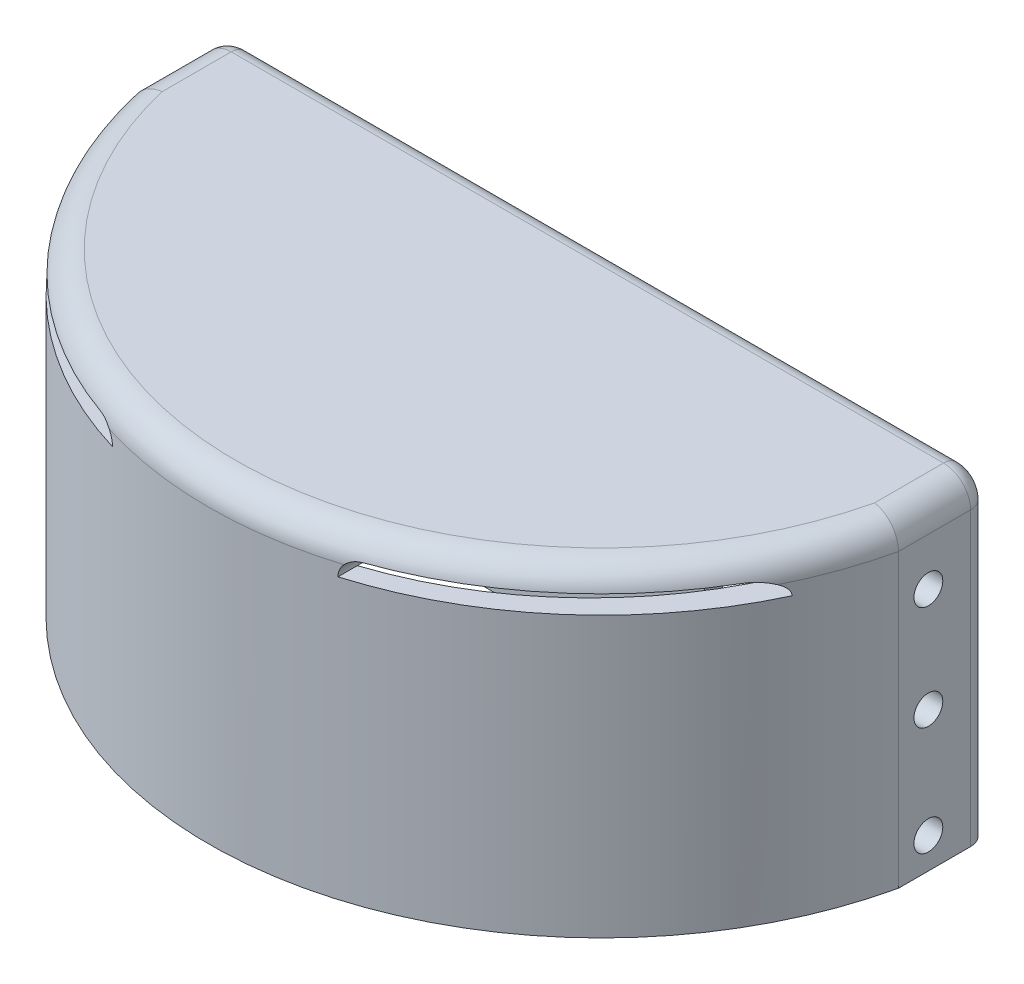
from build123d import *

# Parameters (mm, degrees)
IZIM1_R                          = 2.5
Y_KSEKLIK_EKSTR_ZYON1_DEPTH      = 2
IZIM2_W                          = 25
IZIM2_H                          = 31
Y_KSEKLIK_EKSTR_ZYON2_DEPTH      = 2
IZIM3_W                          = 0.888238836
IZIM3_H                          = 3.17016103
KES_EKSTR_ZYON1_DEPTH            = 2
IZIM6_W                          = 3
IZIM6_H                          = 31
Y_KSEKLIK_EKSTR_ZYON3_DEPTH      = 10
IZIM7_R                          = 1.6
KES_EKSTR_ZYON2_DEPTH            = 141
IZIM8_W                          = 4.55247788
IZIM8_H                          = 5.743045402
Y_KSEKLIK_EKSTR_ZYON4_DEPTH      = 2
Y_KSEKLIK_EKSTR_ZYON5_DEPTH      = 31
Y_KSEKLIK_EKSTR_ZYON6_REACH      = 85.274
Y_KSEKLIK_EKSTR_ZYON6_END_RADIUS = 43.5625
RADYUS1_R                        = 3
RADYUS2_R                        = 2
IZIM11_W                         = 25
IZIM11_H                         = 20
KES_EKSTR_ZYON3_DEPTH            = 10
Y_KSEKLIK_EKSTR_ZYON7_DEPTH      = 2


with BuildPart() as part:
    # Çizim1 → Yükseklik-Ekstrüzyon1 (new body)
    with BuildSketch(Plane.XY):
        with BuildLine():
            Line((-11.5, 17.5), (11.5, 17.5))
            ThreePointArc((11.5, 17.5), (12.914213562, 16.914213562), (13.5, 15.5))
            Line((13.5, 15.5), (13.5, -15.5))
            ThreePointArc((13.5, -15.5), (12.914213562, -16.914213562), (11.5, -17.5))
            Line((11.5, -17.5), (-11.5, -17.5))
            ThreePointArc((-11.5, -17.5), (-12.914213562, -16.914213562), (-13.5, -15.5))
            Line((-13.5, -15.5), (-13.5, 15.5))
            ThreePointArc((-13.5, 15.5), (-12.914213562, 16.914213562), (-11.5, 17.5))
        make_face()
        with Locations((-10, 14)):
            Circle(IZIM1_R, mode=Mode.SUBTRACT)
        with Locations((-10, -14)):
            Circle(IZIM1_R, mode=Mode.SUBTRACT)
        with Locations((10, 14)):
            Circle(IZIM1_R, mode=Mode.SUBTRACT)
        with Locations((10, -14)):
            Circle(IZIM1_R, mode=Mode.SUBTRACT)
    y_kseklik_ekstr_zyon1 = extrude(amount=Y_KSEKLIK_EKSTR_ZYON1_DEPTH)

    # Çizim2 → Yükseklik-Ekstrüzyon2 (add)
    with BuildSketch(Plane(origin=(0, 0, 0), x_dir=(-1, 0, 0), z_dir=(0, 0, -1))):
        with Locations((26, 0)):
            Rectangle(IZIM2_W, IZIM2_H)
    extrude(amount=-Y_KSEKLIK_EKSTR_ZYON2_DEPTH)

    # Çizim3 → Kes-Ekstrüzyon1 (cut)
    with BuildSketch(Plane(origin=(0, 0, 0), x_dir=(-1, 0, 0), z_dir=(0, 0, -1))):
        with Locations((26.444119418, 13.914919485)):
            Rectangle(IZIM3_W, IZIM3_H)
    extrude(amount=-KES_EKSTR_ZYON1_DEPTH, mode=Mode.SUBTRACT)

    # Aynalama4: Yükseklik-Ekstrüzyon1 across plane
    add(y_kseklik_ekstr_zyon1.mirror(Plane(origin=(-26, 15.5, 2), x_dir=(0, 0, 1), z_dir=(1, 0, 0))))

    # Çizim6 → Yükseklik-Ekstrüzyon3 (add)
    with BuildSketch(Plane(origin=(0, 0, 0), x_dir=(-1, 0, 0), z_dir=(0, 0, -1))):
        with Locations((-15, 0)):
            Rectangle(IZIM6_W, IZIM6_H)
        with Locations((67, 0)):
            Rectangle(IZIM6_W, IZIM6_H)
    extrude(amount=-Y_KSEKLIK_EKSTR_ZYON3_DEPTH)

    # Çizim7 → Kes-Ekstrüzyon2 (cut)
    with BuildSketch(Plane(origin=(16.5, 0, 0), x_dir=(0, 0, -1), z_dir=(1, 0, 0))):
        with Locations((-6.681859939, 11.575153699)):
            Circle(IZIM7_R)
        with Locations((-6.681859939, 0)):
            Circle(IZIM7_R)
        with Locations((-6.681859939, -12.069818387)):
            Circle(IZIM7_R)
    extrude(amount=-KES_EKSTR_ZYON2_DEPTH, mode=Mode.SUBTRACT)

    # Çizim8 → Yükseklik-Ekstrüzyon4 (add)
    with BuildSketch(Plane(origin=(0, 0, 0), x_dir=(-1, 0, 0), z_dir=(0, 0, -1))):
        with Locations((26.803888867, 12.628477299)):
            Rectangle(IZIM8_W, IZIM8_H)
    extrude(amount=-Y_KSEKLIK_EKSTR_ZYON4_DEPTH)

    # Çizim9 → Yükseklik-Ekstrüzyon5 (add)
    with BuildSketch(Plane.XZ.offset(15.5)):
        with BuildLine():
            Line((-68.5, 10), (-65.5, 10))
            ThreePointArc((-65.5, 10), (-26, 42), (13.5, 10))
            Line((13.5, 10), (16.5, 10))
            ThreePointArc((16.5, 10), (-26, 44), (-68.5, 10))
        make_face()
    extrude(amount=-Y_KSEKLIK_EKSTR_ZYON5_DEPTH)

    # Yükseklik-Ekstrüzyon6: up to this cylinder (the profile starts inside it)
    y_kseklik_ekstr_zyon6_end = Plane(origin=(-26, 18.142911, 0.4375), z_dir=(0, -1, 0)) * Cylinder(Y_KSEKLIK_EKSTR_ZYON6_END_RADIUS, 258.673, mode=Mode.PRIVATE)
    # Çizim10 → Yükseklik-Ekstrüzyon6 (add, up to the surface)
    with BuildSketch(Plane(origin=(0, 0, 0), x_dir=(-1, 0, 0), z_dir=(0, 0, -1)), mode=Mode.PRIVATE) as y_kseklik_ekstr_zyon6_sk1:
        with BuildLine():
            Line((68.5, 19.845287322), (68.5, 15.5))
            Line((68.5, 15.5), (65.5, 15.5))
            ThreePointArc((65.5, 15.5), (64.914213562, 16.914213562), (63.5, 17.5))
            Line((63.5, 17.5), (40.5, 17.5))
            ThreePointArc((40.5, 17.5), (39.085786438, 16.914213562), (38.5, 15.5))
            Line((38.5, 15.5), (13.5, 15.5))
            ThreePointArc((13.5, 15.5), (12.914213562, 16.914213562), (11.5, 17.5))
            Line((11.5, 17.5), (-11.5, 17.5))
            ThreePointArc((-11.5, 17.5), (-12.914213562, 16.914213562), (-13.5, 15.5))
            Line((-13.5, 15.5), (-16.5, 15.5))
            Line((-16.5, 15.5), (-16.5, 19.845287322))
            Line((-16.5, 19.845287322), (68.5, 19.845287322))
        make_face()
    y_kseklik_ekstr_zyon6_tool1 = extrude(y_kseklik_ekstr_zyon6_sk1.sketch, amount=-Y_KSEKLIK_EKSTR_ZYON6_REACH, mode=Mode.PRIVATE) & y_kseklik_ekstr_zyon6_end
    add(y_kseklik_ekstr_zyon6_tool1.solids().sort_by_distance((-26, 18.142911, 0))[0])

    # Radyus1
    # the kernel refuses this fillet: 3 mm, written as the material it takes off along each edge
    with BuildSketch(Plane(origin=(-68.5, 19.845287322, -7.5), x_dir=(1, 0, 0), z_dir=(0, 0, 1)), Plane(origin=(16.5, 19.845287322, -7.5), x_dir=(0, -1, 0), z_dir=(0, 0, 1))) as radyus1_piece_1:
        with BuildLine():
            CenterArc((RADYUS1_R, -RADYUS1_R), RADYUS1_R, 90, 90)
            Line((0, -RADYUS1_R), (0, 0))
            Line((0, 0), (RADYUS1_R, 0))
        make_face()
    extrude(amount=25, mode=Mode.SUBTRACT)
    with BuildSketch(Plane(origin=(-26, 19.845287322, 0.4375), x_dir=(0.9988024950915276, 0, 0.04892418419288032), z_dir=(0.04892418419288032, 0, -0.9988024950915276))) as radyus1_piece_2:
        with BuildLine():
            CenterArc((43.5625 - RADYUS1_R, RADYUS1_R), RADYUS1_R, 270, 90)
            Line((43.5625 - RADYUS1_R, 0), (43.5625, 0))
            Line((43.5625, 0), (43.5625, RADYUS1_R))
        make_face()
    revolve(axis=Axis((-26, 19.845287322, 0.4375), (0, -1, 0)), revolution_arc=174.39146253, mode=Mode.SUBTRACT)

    # Radyus2
    radyus2_edges = [part.edges().sort_by_distance(p)[0] for p in [
        (-68.5, 0.672643661, 0),
        (-26, 19.845287322, 0),
        (16.5, 0.672643661, 0),
        (-67.621320344, 18.966607666, 0),
        (15.621320344, 18.966607666, 0),
    ]]
    fillet(radyus2_edges, radius=RADYUS2_R)

    # Çizim11 → Kes-Ekstrüzyon3 (cut)
    with BuildSketch(Plane(origin=(0, 0, 0), x_dir=(-1, 0, 0), z_dir=(0, 0, -1))):
        with Locations((51.5, 1)):
            Rectangle(IZIM11_W, IZIM11_H)
        with Locations((0.5, 1)):
            Rectangle(IZIM11_W, IZIM11_H)
    extrude(amount=-KES_EKSTR_ZYON3_DEPTH, mode=Mode.SUBTRACT)

    # Çizim12 → Yükseklik-Ekstrüzyon7 (add)
    with BuildSketch(Plane(origin=(0, 0, 0), x_dir=(-1, 0, 0), z_dir=(0, 0, -1))):
        with BuildLine():
            Line((11.5, -17.5), (40.5, -17.5))
            ThreePointArc((40.5, -17.5), (39.085786438, -16.914213562), (38.5, -15.5))
            Line((38.5, -15.5), (13.5, -15.5))
            ThreePointArc((13.5, -15.5), (12.914213562, -16.914213562), (11.5, -17.5))
        make_face()
    extrude(amount=-Y_KSEKLIK_EKSTR_ZYON7_DEPTH)


solid = part.part
